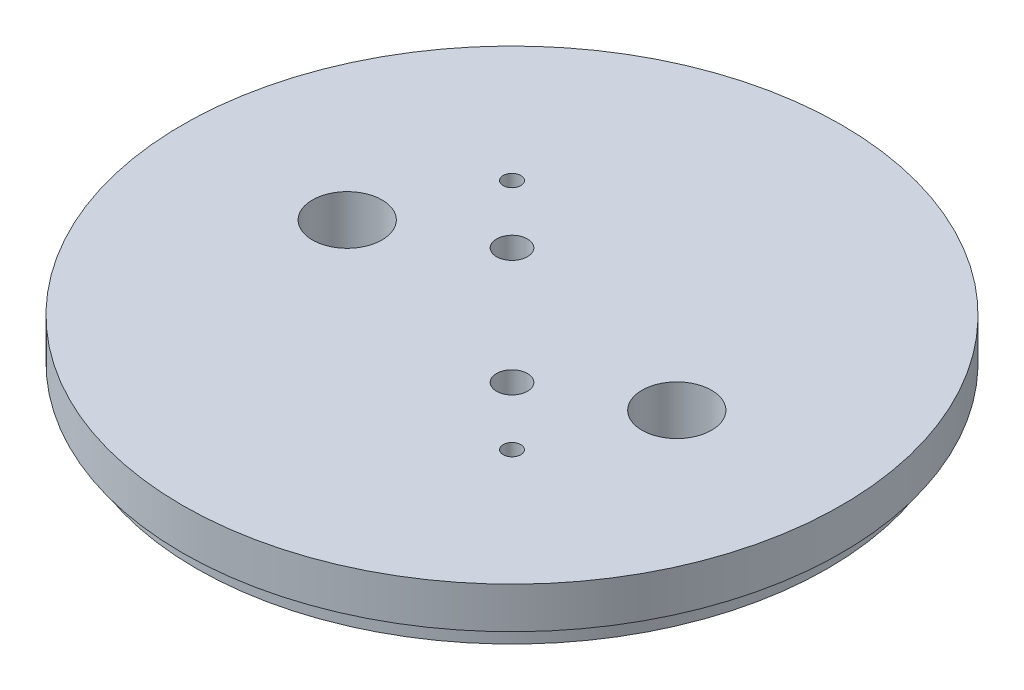
from build123d import *

# Parameters (mm, degrees)
SKETCH1_R           = 50.8
SKETCH1_R_2         = 5.3578125
SKETCH1_R_3         = 1.3589
SKETCH1_R_4         = 2.38125
BOSS_EXTRUDE1_DEPTH = 9.525
SKETCH2_R           = 50.8
SKETCH2_R_2         = 48.641
CUT_EXTRUDE1_DEPTH  = 3.175
CUT_EXTRUDE2_START  = -5.969
CUT_EXTRUDE2_DEPTH  = 3.556


with BuildPart() as part:
    # Sketch1 → Boss-Extrude1 (new body)
    with BuildSketch(Plane(origin=(0, 0, 0), x_dir=(1, 0, 0), z_dir=(0, 1, 0))):
        Circle(SKETCH1_R)
        with Locations((25.4, 0)):
            Circle(SKETCH1_R_2, mode=Mode.SUBTRACT)
        with Locations((-25.4, 0)):
            Circle(SKETCH1_R_2, mode=Mode.SUBTRACT)
        with Locations((-17.960512242, 17.960512242)):
            Circle(SKETCH1_R_3, mode=Mode.SUBTRACT)
        with Locations((17.960512242, -17.960512242)):
            Circle(SKETCH1_R_3, mode=Mode.SUBTRACT)
        with Locations((-8.980256121, 8.980256121)):
            Circle(SKETCH1_R_4, mode=Mode.SUBTRACT)
        with Locations((8.980256121, -8.980256121)):
            Circle(SKETCH1_R_4, mode=Mode.SUBTRACT)
    extrude(amount=BOSS_EXTRUDE1_DEPTH)

    # Sketch2 → Cut-Extrude1 (cut)
    with BuildSketch(Plane.XZ):
        Circle(SKETCH2_R)
        Circle(SKETCH2_R_2, mode=Mode.SUBTRACT)
    extrude(amount=-CUT_EXTRUDE1_DEPTH, mode=Mode.SUBTRACT)

    # Sketch3 → Cut-Extrude2 (cut)
    with BuildSketch(Plane(origin=(0, 9.525, 0), x_dir=(1, 0, 0), z_dir=(0, 1, 0)).offset(CUT_EXTRUDE2_START)):
        with BuildLine():
            Line((3.2385, 34.798), (3.2385, 13.97))
            ThreePointArc((3.2385, 13.97), (0, 10.7315), (-3.2385, 13.97))
            Line((-3.2385, 13.97), (-3.2385, 34.798))
            ThreePointArc((-3.2385, 34.798), (0, 38.0365), (3.2385, 34.798))
        make_face()
        with BuildLine():
            Line((3.2385, -34.798), (3.2385, -13.97))
            ThreePointArc((3.2385, -13.97), (0, -10.7315), (-3.2385, -13.97))
            Line((-3.2385, -13.97), (-3.2385, -34.798))
            ThreePointArc((-3.2385, -34.798), (0, -38.0365), (3.2385, -34.798))
        make_face()
    extrude(amount=-CUT_EXTRUDE2_DEPTH, mode=Mode.SUBTRACT)


solid = part.part
